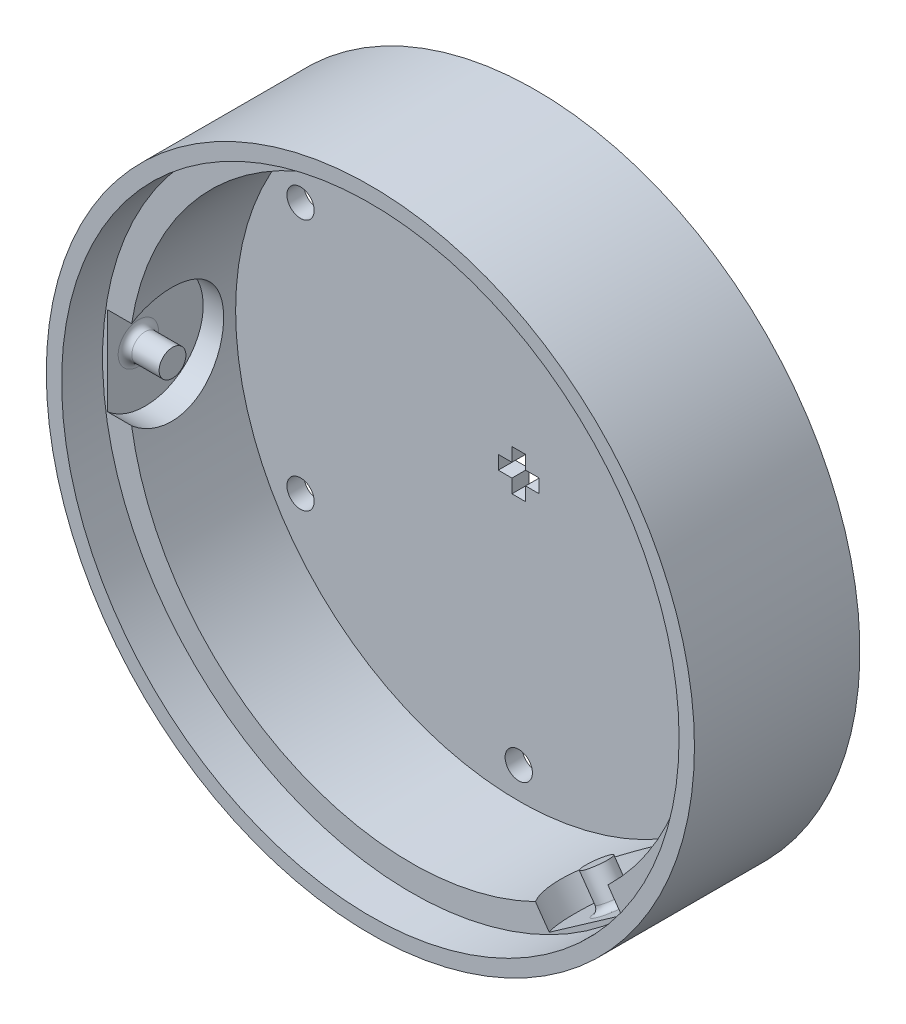
from build123d import *
from build123d.topology import SkipClean

# Parameters (mm, degrees)
CROQUIS1_R                   = 95
SALIENTE_EXTRUIR1_DEPTH      = 106
CROQUIS2_R                   = 83
CORTAR_EXTRUIR1_DEPTH        = 100
CROQUIS3_R                   = 90.5
CORTAR_EXTRUIR2_DEPTH        = 12
CROQUIS4_R                   = 17
CORTAR_EXTRUIR4_DEPTH        = 89
SALIENTE_EXTRUIR2_DEPTH      = 0.001
SALIENTE_EXTRUIR2_DEPTH_BACK = 89
CROQUIS5_R                   = 3.925
CORTAR_EXTRUIR5_DEPTH        = 79
CORTAR_EXTRUIR5_DEPTH_BACK   = 79
CROQUIS6_R                   = 3.925
CORTAR_EXTRUIR6_START        = 81.240384105
CORTAR_EXTRUIR6_DEPTH        = 7.759615895
CROQUIS7_R                   = 3.925
SALIENTE_EXTRUIR3_DEPTH      = 10
CORTAR_EXTRUIR10_START       = 81.240383801
CORTAR_EXTRUIR10_DEPTH       = 7.759616199
CROQUIS8_R                   = 3.925
SALIENTE_EXTRUIR4_DEPTH      = 10
REDONDEO2_R                  = 2
CORTAR_EXTRUIR11_DEPTH       = 21
CROQUIS13_R                  = 2.5
CORTAR_EXTRUIR12_DEPTH       = 10
CROQUIS14_R                  = 95
CORTAR_EXTRUIR13_DEPTH       = 60
CROQUIS15_R                  = 95
SALIENTE_EXTRUIR5_DEPTH      = 2.5
CORTAR_EXTRUIR14_DEPTH       = 5
CROQUIS17_R                  = 4
CORTAR_EXTRUIR16_DEPTH       = 5


# Read off the part's stored shape, not the designer's step: Cortar-Extruir6, Cortar-Extruir10
with BuildPart() as part:
    # Croquis1 → Saliente-Extruir1 (new body)
    with BuildSketch(Plane.XY):
        Circle(CROQUIS1_R)
    extrude(amount=SALIENTE_EXTRUIR1_DEPTH)

    # Croquis2 → Cortar-Extruir1 (cut)
    with BuildSketch(Plane.XY.offset(106)):
        Circle(CROQUIS2_R)
    extrude(amount=-CORTAR_EXTRUIR1_DEPTH, mode=Mode.SUBTRACT)

    # Croquis3 → Cortar-Extruir2 (cut)
    with BuildSketch(Plane.XY.offset(106)):
        Circle(CROQUIS3_R)
    extrude(amount=-CORTAR_EXTRUIR2_DEPTH, mode=Mode.SUBTRACT)

    # Croquis4 → Cortar-Extruir4 (cut)
    with BuildSketch(Plane(origin=(0, 0, 0), x_dir=(0, 0, -1), z_dir=(1, 0, 0))):
        with Locations((-83, 0)):
            Circle(CROQUIS4_R)
    extrude(amount=-CORTAR_EXTRUIR4_DEPTH, mode=Mode.SUBTRACT)

    # Croquis5 → Saliente-Extruir2 (add, two sides: drawn at the far end of the back side and taken through both)
    with BuildSketch(Plane(origin=(0, 0, 0), x_dir=(0, 0, -1), z_dir=(1, 0, 0)).offset(-SALIENTE_EXTRUIR2_DEPTH_BACK)):
        with Locations((-85, 0)):
            Circle(CROQUIS5_R)
    extrude(amount=SALIENTE_EXTRUIR2_DEPTH + SALIENTE_EXTRUIR2_DEPTH_BACK)

    # Croquis6 → Cortar-Extruir5 (cut, two sides: drawn at the far end of the back side and taken through both)
    with BuildSketch(Plane(origin=(0, 0, 0), x_dir=(0, 0, -1), z_dir=(1, 0, 0)).offset(-CORTAR_EXTRUIR5_DEPTH_BACK)):
        with Locations((-85, 0)):
            Circle(CROQUIS6_R)
    extrude(amount=CORTAR_EXTRUIR5_DEPTH + CORTAR_EXTRUIR5_DEPTH_BACK, mode=Mode.SUBTRACT)

    # Cortar-Extruir6 outline → Cortar-Extruir6 (cut)
    with BuildSketch(Plane(origin=(0, 0, 0), x_dir=(0.8191520442889906, 0.5735764363510478, 0), z_dir=(0.5735764363510478, -0.8191520442889907, 0)).offset(CORTAR_EXTRUIR6_START)):
        with BuildLine():
            Line((12.961481397, 94), (-12.961481397, 94))
            ThreePointArc((-12.961481397, 94), (0, 66), (12.961481397, 94))
        make_face()
    extrude(amount=CORTAR_EXTRUIR6_DEPTH, mode=Mode.SUBTRACT)

    # Croquis7 → Saliente-Extruir3 (add)
    with BuildSketch(Plane(origin=(51.048302836, -72.904531941, 0), x_dir=(0.8191520442843079, 0.5735764363577354, 2.1722123141071213e-13), z_dir=(-0.5735764363577354, 0.8191520442843079, 3.1022406865588427e-13))):
        with Locations((0, -85)):
            Circle(CROQUIS7_R)
    extrude(amount=SALIENTE_EXTRUIR3_DEPTH)

    # Cortar-Extruir10 outline → Cortar-Extruir10 (cut)
    with BuildSketch(Plane(origin=(0, 0, 0), x_dir=(0.7660444431189818, -0.642787609686535, 0), z_dir=(0.6427876096865349, 0.7660444431189818, 0)).offset(CORTAR_EXTRUIR10_START)):
        with BuildLine():
            Line((-14.422205102, -94), (14.422205102, -94))
            ThreePointArc((14.422205102, -94), (0, -68), (-14.422205102, -94))
        make_face()
    extrude(amount=CORTAR_EXTRUIR10_DEPTH, mode=Mode.SUBTRACT)

    # Croquis8 → Saliente-Extruir4 (add)
    with BuildSketch(Plane(origin=(57.208097263, 68.177955437, 0), x_dir=(0.7660444431126934, -0.642787609694029, -3.1196544125319357e-13), z_dir=(-0.642787609694029, -0.7660444431126934, -3.717859353713491e-13))):
        with Locations(Location((0, 85, 0), (0, 0, 180))):
            Circle(CROQUIS8_R)
    extrude(amount=SALIENTE_EXTRUIR4_DEPTH)

    # Redondeo2
    redondeo2_edges = [part.edges().sort_by_distance(p)[0] for p in [
        (-89, 0, 88.925),
        (47.833131062, -75.155819454, 85),
        (60.214821702, 65.655014069, 85),
    ]]
    fillet(redondeo2_edges, radius=REDONDEO2_R)

    # Croquis12 → Cortar-Extruir11 (cut)
    with BuildSketch(Plane.XY.offset(6)):
        Polygon((-2, 6), (2, 6), (2, 2), (6, 2), (6, -2), (2, -2), (2, -6), (-2, -6), (-2, -2), (-6, -2), (-6, 2), (-2, 2), align=None)
    extrude(amount=-CORTAR_EXTRUIR11_DEPTH, mode=Mode.SUBTRACT)

    # Croquis13 → Cortar-Extruir12 (cut)
    with BuildSketch(Plane.XY.offset(6)):
        with Locations((0, 77.833820013)):
            Circle(CROQUIS13_R)
        with Locations((77.833820013, 0)):
            Circle(CROQUIS13_R)
        with Locations((0, -77.833820013)):
            Circle(CROQUIS13_R)
        with Locations((-77.833820013, 0)):
            Circle(CROQUIS13_R)
    extrude(amount=-CORTAR_EXTRUIR12_DEPTH, mode=Mode.SUBTRACT)

    # Croquis14 → Cortar-Extruir13 (cut)
    with BuildSketch(Plane(origin=(0, 0, 0), x_dir=(-1, 0, 0), z_dir=(0, 0, -1))):
        Circle(CROQUIS14_R)
    extrude(amount=-CORTAR_EXTRUIR13_DEPTH, mode=Mode.SUBTRACT)

    # Croquis15 → Saliente-Extruir5 (add, symmetric)
    with SkipClean():  # the faces are left unmerged after this step: merging them gives an invalid solid
        with BuildSketch(Plane(origin=(0, 0, 60), x_dir=(-1, 0, 0), z_dir=(0, 0, -1))):
            Circle(CROQUIS15_R)
        extrude(amount=SALIENTE_EXTRUIR5_DEPTH, both=True)
    add(part.part.scale(1), mode=Mode.REPLACE)  # the faces are merged on a copy

    # Croquis16 → Cortar-Extruir14 (cut)
    with BuildSketch(Plane(origin=(0, 0, 57.5), x_dir=(-1, 0, 0), z_dir=(0, 0, -1))):
        Polygon((-2, 6), (2, 6), (2, 2), (6, 2), (6, -2), (2, -2), (2, -6), (-2, -6), (-2, -2), (-6, -2), (-6, 2), (-2, 2), align=None)
    extrude(amount=-CORTAR_EXTRUIR14_DEPTH, mode=Mode.SUBTRACT)

    # Croquis17 → Cortar-Extruir16 (cut)
    with BuildSketch(Plane(origin=(0, 0, 57.5), x_dir=(-1, 0, 0), z_dir=(0, 0, -1))):
        with Locations((0, 73.859779167)):
            Circle(CROQUIS17_R)
        with Locations((63.964445077, 36.929889584)):
            Circle(CROQUIS17_R)
        with Locations((63.964445077, -36.929889584)):
            Circle(CROQUIS17_R)
        with Locations((0, -73.859779167)):
            Circle(CROQUIS17_R)
        with Locations((-63.964445077, -36.929889584)):
            Circle(CROQUIS17_R)
        with Locations((-63.964445077, 36.929889584)):
            Circle(CROQUIS17_R)
    extrude(amount=-CORTAR_EXTRUIR16_DEPTH, mode=Mode.SUBTRACT)


solid = part.part
